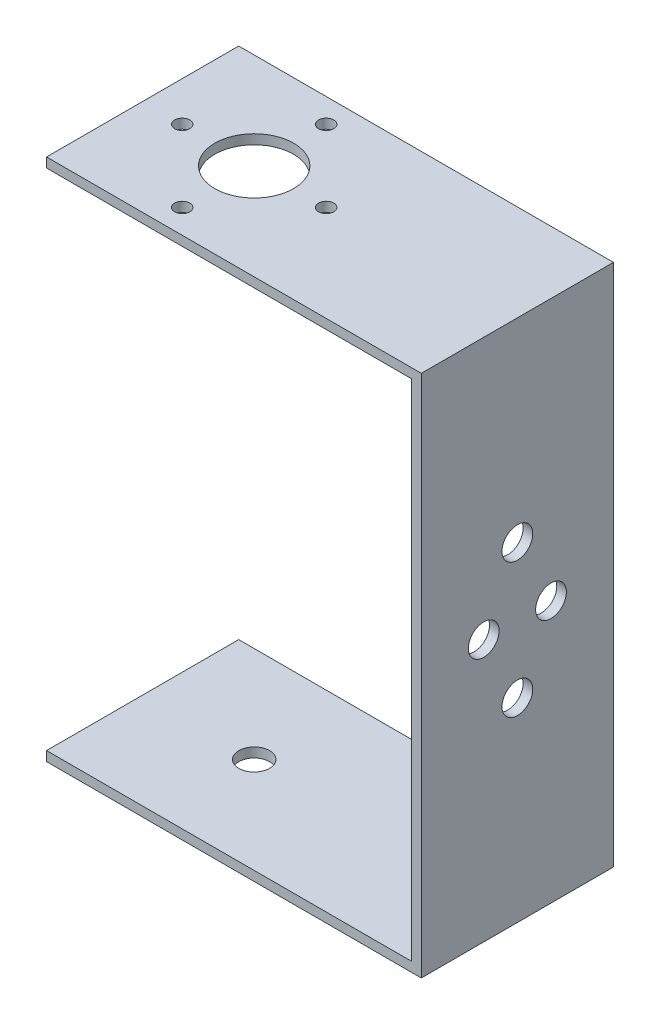
from build123d import *

# Parameters (mm, degrees)
SKETCH_1_W           = 20
SKETCH_1_H           = 54.5
EXTRUDE_1_DEPTH      = 1
SKETCH_2_W           = 20
SKETCH_2_H           = 1
EXTRUDE_2_DEPTH      = 38
SKETCH_3_W           = 20
SKETCH_3_H           = 1
EXTRUDE_3_DEPTH      = 38
SKETCH_4_R           = 4.1
CUT_EXTRUDE_1_DEPTH  = 1
SKETCH_5_R           = 0.79
CUT_EXTRUDE_2_DEPTH  = 1
SKETCH_6_R           = 0.79
CUT_EXTRUDE_3_DEPTH  = 1
SKETCH_7_R           = 0.79
CUT_EXTRUDE_4_DEPTH  = 1
SKETCH_8_R           = 0.79
CUT_EXTRUDE_5_DEPTH  = 1
SKETCH_9_R           = 1.6
CUT_EXTRUDE_6_DEPTH  = 1
SKETCH_10_R          = 1.6
CUT_EXTRUDE_7_DEPTH  = 1
SKETCH_11_R          = 1.6
CUT_EXTRUDE_8_DEPTH  = 1
SKETCH_12_R          = 1.6
CUT_EXTRUDE_9_DEPTH  = 1
SKETCH_13_R          = 1.6
CUT_EXTRUDE_10_DEPTH = 1


with BuildPart() as part:
    # ｽｹｯﾁ1 → ﾎﾞｽ - 押し出し1 (new body)
    with BuildSketch(Plane(origin=(0, 0, 0), x_dir=(0, 0, -1), z_dir=(1, 0, 0))):
        with Locations((10, 27.25)):
            Rectangle(SKETCH_1_W, SKETCH_1_H)
    extrude(amount=EXTRUDE_1_DEPTH)

    # ｽｹｯﾁ2 → ﾎﾞｽ - 押し出し2 (add)
    with BuildSketch(Plane.ZY):
        with Locations((-10, 54)):
            Rectangle(SKETCH_2_W, SKETCH_2_H)
    extrude(amount=EXTRUDE_2_DEPTH)

    # ｽｹｯﾁ3 → ﾎﾞｽ - 押し出し3 (add)
    with BuildSketch(Plane.ZY):
        with Locations((-10, 0.5)):
            Rectangle(SKETCH_3_W, SKETCH_3_H)
    extrude(amount=EXTRUDE_3_DEPTH)

    # ｽｹｯﾁ4 → ｶｯﾄ - 押し出し1 (cut)
    with BuildSketch(Plane(origin=(0, 54.5, 0), x_dir=(1, 0, 0), z_dir=(0, 1, 0))):
        with Locations((-26.39, 10)):
            Circle(SKETCH_4_R)
    extrude(amount=-CUT_EXTRUDE_1_DEPTH, mode=Mode.SUBTRACT)

    # ｽｹｯﾁ5 → ｶｯﾄ - 押し出し2 (cut)
    with BuildSketch(Plane(origin=(0, 54.5, 0), x_dir=(1, 0, 0), z_dir=(0, 1, 0))):
        with Locations((-33.88, 10)):
            Circle(SKETCH_5_R)
    extrude(amount=-CUT_EXTRUDE_2_DEPTH, mode=Mode.SUBTRACT)

    # ｽｹｯﾁ6 → ｶｯﾄ - 押し出し3 (cut)
    with BuildSketch(Plane(origin=(0, 54.5, 0), x_dir=(1, 0, 0), z_dir=(0, 1, 0))):
        with Locations((-18.9, 10)):
            Circle(SKETCH_6_R)
    extrude(amount=-CUT_EXTRUDE_3_DEPTH, mode=Mode.SUBTRACT)

    # ｽｹｯﾁ7 → ｶｯﾄ - 押し出し4 (cut)
    with BuildSketch(Plane(origin=(0, 54.5, 0), x_dir=(1, 0, 0), z_dir=(0, 1, 0))):
        with Locations((-26.39, 2.51)):
            Circle(SKETCH_7_R)
    extrude(amount=-CUT_EXTRUDE_4_DEPTH, mode=Mode.SUBTRACT)

    # ｽｹｯﾁ8 → ｶｯﾄ - 押し出し5 (cut)
    with BuildSketch(Plane(origin=(0, 54.5, 0), x_dir=(1, 0, 0), z_dir=(0, 1, 0))):
        with Locations((-26.39, 17.49)):
            Circle(SKETCH_8_R)
    extrude(amount=-CUT_EXTRUDE_5_DEPTH, mode=Mode.SUBTRACT)

    # ｽｹｯﾁ9 → ｶｯﾄ - 押し出し6 (cut)
    with BuildSketch(Plane(origin=(0, 0, 0), x_dir=(-1, 0, 0), z_dir=(0, -1, 0))):
        with Locations((26.39, 10)):
            Circle(SKETCH_9_R)
    extrude(amount=-CUT_EXTRUDE_6_DEPTH, mode=Mode.SUBTRACT)

    # ｽｹｯﾁ10 → ｶｯﾄ - 押し出し7 (cut)
    with BuildSketch(Plane(origin=(1, 0, 0), x_dir=(0, 0, -1), z_dir=(1, 0, 0))):
        with Locations((6.5, 27.25)):
            Circle(SKETCH_10_R)
    extrude(amount=-CUT_EXTRUDE_7_DEPTH, mode=Mode.SUBTRACT)

    # ｽｹｯﾁ11 → ｶｯﾄ - 押し出し8 (cut)
    with BuildSketch(Plane(origin=(1, 0, 0), x_dir=(0, 0, -1), z_dir=(1, 0, 0))):
        with Locations((10, 34.25)):
            Circle(SKETCH_11_R)
    extrude(amount=-CUT_EXTRUDE_8_DEPTH, mode=Mode.SUBTRACT)

    # ｽｹｯﾁ12 → ｶｯﾄ - 押し出し9 (cut)
    with BuildSketch(Plane(origin=(1, 0, 0), x_dir=(0, 0, -1), z_dir=(1, 0, 0))):
        with Locations((13.5, 27.25)):
            Circle(SKETCH_12_R)
    extrude(amount=-CUT_EXTRUDE_9_DEPTH, mode=Mode.SUBTRACT)

    # ｽｹｯﾁ13 → ｶｯﾄ - 押し出し10 (cut)
    with BuildSketch(Plane(origin=(1, 0, 0), x_dir=(0, 0, -1), z_dir=(1, 0, 0))):
        with Locations((10, 20.25)):
            Circle(SKETCH_13_R)
    extrude(amount=-CUT_EXTRUDE_10_DEPTH, mode=Mode.SUBTRACT)


solid = part.part
